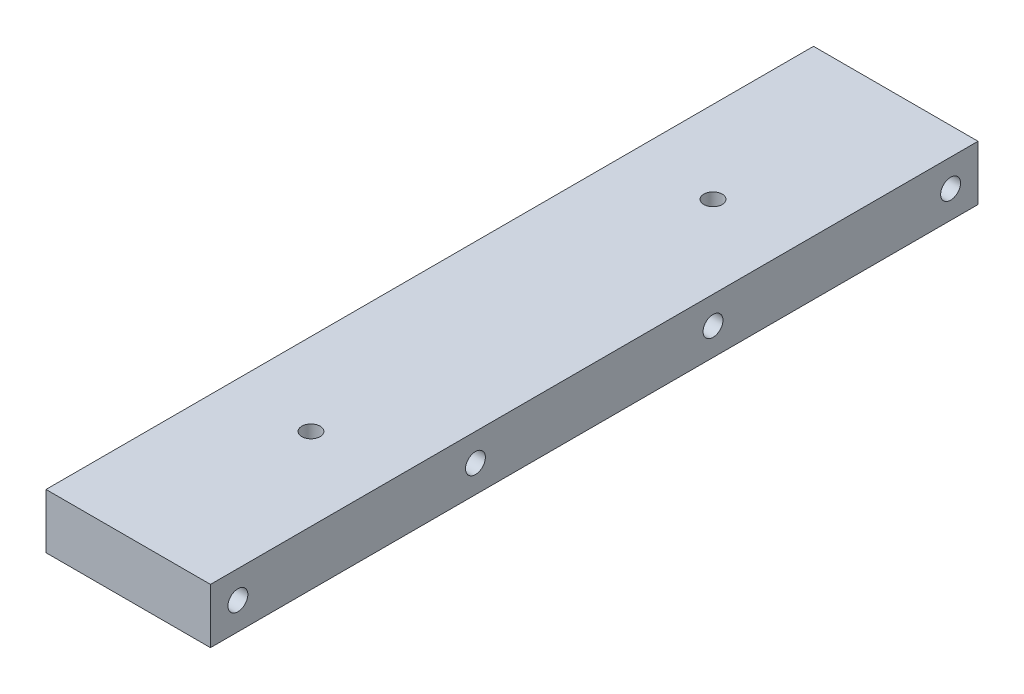
from build123d import *

# Parameters (mm, degrees)
SKETCH2_W           = 28.575
SKETCH2_H           = 133.35
BOSS_EXTRUDE1_DEPTH = 9.525
LPATTERN1_COUNT     = 4
LPATTERN1_PITCH     = 41.275
LPATTERN2_COUNT     = 4
LPATTERN2_PITCH     = 41.275
SKETCH8_R           = 1.5875
CUT_EXTRUDE2_DEPTH  = 137.709468399


with BuildPart() as part:
    # Sketch2 → Boss-Extrude1 (new body)
    with BuildSketch(Plane(origin=(0, 0, 0), x_dir=(1, 0, 0), z_dir=(0, 1, 0))):
        with Locations((14.2875, 66.675)):
            Rectangle(SKETCH2_W, SKETCH2_H)
    extrude(amount=BOSS_EXTRUDE1_DEPTH)

    # Sketch5 → #5 Clearance Hole1 (revolve, cut)
    with BuildSketch(Plane(origin=(28.575, 4.7625, -4.7625), x_dir=(0, 0, -1), z_dir=(0, 1, 0))):
        Polygon((0, 0), (0, 13.737806461), (1.7272, 12.7), (1.7272, 0), align=None)
    f_5_clearance_hole1 = revolve(axis=Axis((34.925, 4.7625, -4.7625), (-1, 0, 0)), mode=Mode.SUBTRACT)

    # LPattern1: #5 Clearance Hole1 ×4
    with Locations(*[(0, 0, -i * LPATTERN1_PITCH) for i in range(1, LPATTERN1_COUNT)]):
        add(f_5_clearance_hole1, mode=Mode.SUBTRACT)

    # Sketch7 → #5 Clearance Hole2 (revolve, cut)
    with BuildSketch(Plane(origin=(0, 4.7625, -128.5875), x_dir=(0, 0, 1), z_dir=(0, 1, 0))):
        Polygon((0, 0), (0, 13.737806461), (1.7272, 12.7), (1.7272, 0), align=None)
    f_5_clearance_hole2 = revolve(axis=Axis((-6.35, 4.7625, -128.5875), (1, 0, 0)), mode=Mode.SUBTRACT)

    # LPattern2: #5 Clearance Hole2 ×4
    with Locations(*[(0, 0, i * LPATTERN2_PITCH) for i in range(1, LPATTERN2_COUNT)]):
        add(f_5_clearance_hole2, mode=Mode.SUBTRACT)

    # Sketch8 → Cut-Extrude2 (cut, through all)
    with BuildSketch(Plane.XZ):
        with Locations((14.2875, -31.75)):
            Circle(SKETCH8_R)
        with Locations((14.2875, -101.6)):
            Circle(SKETCH8_R)
    extrude(amount=-CUT_EXTRUDE2_DEPTH, mode=Mode.SUBTRACT)


solid = part.part
